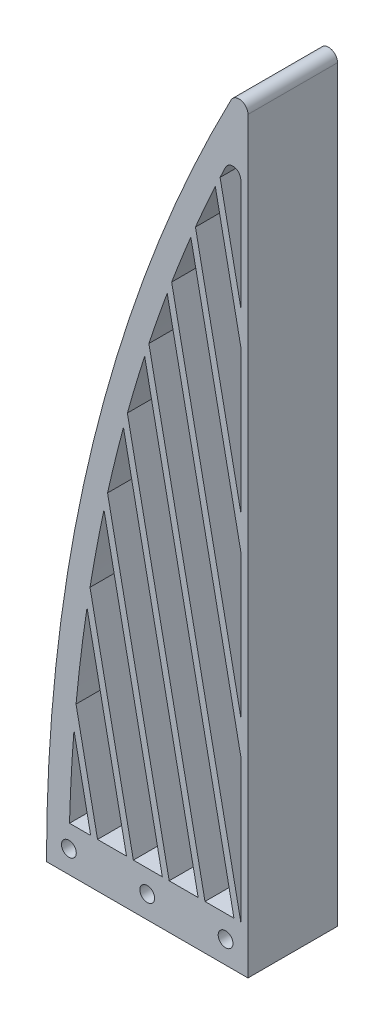
from build123d import *

# Parameters (mm, degrees)
BOSS_EXTRUDE4_DEPTH = 20
SKETCH12_R          = 1.65
CUT_EXTRUDE1_DEPTH  = 177.068006068
BOSS_EXTRUDE5_DEPTH = 20
CUT_EXTRUDE2_START  = -20
CUT_EXTRUDE2_DEPTH  = 20
LPATTERN2_DEPTH     = 20
CUT_EXTRUDE4_START  = -30
CUT_EXTRUDE4_DEPTH  = 30


with BuildPart() as part:
    # Sketch5 → Boss-Extrude4 (new body)
    with BuildSketch(Plane.XY):
        with BuildLine():
            Line((0, 0), (0, 167.041245738))
            ThreePointArc((0, 167.041245738), (-1.523254023, 168.9835931), (-3.772713274, 167.967252028))
            ThreePointArc((-3.772713274, 167.967252028), (-34.542452011, 86.476422979), (-45, 0))
            Line((-45, 0), (0, 0))
        make_face()
        with BuildLine():
            Line((-1.6, 10), (-39.860221142, 10))
            ThreePointArc((-39.860221142, 10), (-30.000299364, 83.996114978), (-5, 154.335493145))
            ThreePointArc((-5, 154.335493145), (-2.992115624, 155.307611869), (-1.6, 153.56444562))
            Line((-1.6, 153.56444562), (-1.6, 10))
        make_face(mode=Mode.SUBTRACT)
    extrude(amount=BOSS_EXTRUDE4_DEPTH)

    # Sketch12 → Cut-Extrude1 (cut, through all)
    with BuildSketch(Plane.XY.offset(20)):
        with Locations((-40, 5)):
            Circle(SKETCH12_R)
        with Locations((-22.5, 5)):
            Circle(SKETCH12_R)
        with Locations((-5, 5)):
            Circle(SKETCH12_R)
    extrude(amount=-CUT_EXTRUDE1_DEPTH, mode=Mode.SUBTRACT)

    # Sketch14 → Boss-Extrude5 (add)
    with BuildSketch(Plane.XY.offset(20)):
        Polygon((-31.6, 158.56444562), (-1.6, 10), (-3.070322034, 9.703094096), (-33.070322034, 158.267539717), align=None)
    extrude(amount=-BOSS_EXTRUDE5_DEPTH)

    # Sketch17 → Cut-Extrude2 (cut)
    with BuildSketch(Plane.XY.offset(20).offset(CUT_EXTRUDE2_START)):
        Polygon((-120.638203698, 868.825955305), (-109.129206393, -31.174044695), (790.870793607, -19.66504739), (784.13367644, 507.175413991), align=None)
        with BuildLine():
            Line((-45, 0), (0, 0))
            Line((0, 0), (0, 167.041245738))
            ThreePointArc((0, 167.041245738), (-1.523254023, 168.9835931), (-3.772713274, 167.967252028))
            ThreePointArc((-3.772713274, 167.967252028), (-34.542452011, 86.476422979), (-45, 0))
        make_face(mode=Mode.SUBTRACT)
    extrude(amount=CUT_EXTRUDE2_DEPTH, mode=Mode.SUBTRACT)

    # LPattern2: read off the stored shape, not the designer's step
    # LPattern2 outline → LPattern2 (add)
    with BuildSketch(Plane.XY):
        with BuildLine():
            ThreePointArc((-26.929923269, 95.820348103), (-27.373467662, 94.210169532), (-27.809490726, 92.59793799))
            Line((-27.809490726, 92.59793799), (-11.130277006, 10))
            Line((-11.130277006, 10), (-9.6, 10))
            Line((-9.6, 10), (-26.929923269, 95.820348103))
        make_face()
        with BuildLine():
            Line((-17.6, 10), (-31.361118804, 78.147099536))
            ThreePointArc((-31.361118804, 78.147099536), (-31.763386373, 76.327667567), (-32.156172589, 74.506165199))
            Line((-32.156172589, 74.506165199), (-19.130277006, 10))
            Line((-19.130277006, 10), (-17.6, 10))
        make_face()
        with BuildLine():
            Line((-25.6, 10), (-35.278805908, 57.930881129))
            ThreePointArc((-35.278805908, 57.930881129), (-35.62097033, 55.805583127), (-35.950341194, 53.67826488))
            Line((-35.950341194, 53.67826488), (-27.130277006, 10))
            Line((-27.130277006, 10), (-25.6, 10))
        make_face()
        with BuildLine():
            Line((-33.6, 10), (-38.401810118, 33.779275272))
            ThreePointArc((-38.401810118, 33.779275272), (-38.642670237, 31.135229386), (-38.863902948, 28.489468942))
            Line((-38.863902948, 28.489468942), (-35.130277006, 10))
            Line((-35.130277006, 10), (-33.6, 10))
        make_face()
        with BuildLine():
            Line((-39.6, 158.56444562), (-41.070322034, 158.267539717))
            Line((-41.070322034, 158.267539717), (-29.975183074, 103.322767425))
            ThreePointArc((-29.975183074, 103.322767425), (-29.520039112, 104.842464839), (-29.058254032, 106.360157429))
            Line((-29.058254032, 106.360157429), (-39.6, 158.56444562))
        make_face()
        with BuildLine():
            Line((-9.070322034, 158.267539717), (-8.948336076, 157.663447176))
            ThreePointArc((-8.948336076, 157.663447176), (-8.779938618, 158.011942308), (-8.611169445, 158.360257578))
            Line((-8.611169445, 158.360257578), (-9.070322034, 158.267539717))
        make_face()
        with BuildLine():
            Line((-17.070322034, 158.267539717), (-14.508363766, 145.580342723))
            ThreePointArc((-14.508363766, 145.580342723), (-13.985146964, 146.768790335), (-13.457679601, 147.955357539))
            Line((-13.457679601, 147.955357539), (-15.6, 158.56444562))
            Line((-15.6, 158.56444562), (-17.070322034, 158.267539717))
        make_face()
        with BuildLine():
            Line((-25.070322034, 158.267539717), (-19.890886638, 132.618208106))
            ThreePointArc((-19.890886638, 132.618208106), (-19.386082828, 133.896404549), (-18.876440608, 135.172679536))
            Line((-18.876440608, 135.172679536), (-23.6, 158.56444562))
            Line((-23.6, 158.56444562), (-25.070322034, 158.267539717))
        make_face()
        with BuildLine():
            ThreePointArc((-42.198101589, 45.000914697), (-41.903670312, 47.296637828), (-41.594598358, 49.590435769))
            Line((-41.594598358, 49.590435769), (-63.6, 158.56444562))
            Line((-63.6, 158.56444562), (-65.070322034, 158.267539717))
            Line((-65.070322034, 158.267539717), (-42.198101589, 45.000914697))
        make_face()
        with BuildLine():
            ThreePointArc((-38.7019538, 67.304658261), (-38.331864724, 69.236107391), (-37.951310909, 71.165521929))
            Line((-37.951310909, 71.165521929), (-55.6, 158.56444562))
            Line((-55.6, 158.56444562), (-57.070322034, 158.267539717))
            Line((-57.070322034, 158.267539717), (-38.7019538, 67.304658261))
        make_face()
        with BuildLine():
            ThreePointArc((-34.559404558, 86.407326039), (-34.139952511, 88.100097378), (-33.712367751, 89.79083275))
            Line((-33.712367751, 89.79083275), (-47.6, 158.56444562))
            Line((-47.6, 158.56444562), (-49.070322034, 158.267539717))
            Line((-49.070322034, 158.267539717), (-34.559404558, 86.407326039))
        make_face()
        with BuildLine():
            ThreePointArc((-17.043254073, 126.094468165), (-17.541868523, 124.762466617), (-18.035183962, 123.428493465))
            Line((-18.035183962, 123.428493465), (-1.6, 42.039026998))
            Line((-1.6, 42.039026998), (-1.6, 49.617185499))
            Line((-1.6, 49.617185499), (-17.043254073, 126.094468165))
        make_face()
        with BuildLine():
            ThreePointArc((-11.728678792, 139.39308932), (-12.247145872, 138.161094529), (-12.761006653, 136.927171366))
            Line((-12.761006653, 136.927171366), (-1.6, 81.656212497))
            Line((-1.6, 81.656212497), (-1.6, 89.234370998))
            Line((-1.6, 89.234370998), (-11.728678792, 139.39308932))
        make_face()
        with BuildLine():
            ThreePointArc((-6.2238307, 151.749451318), (-6.759005375, 150.601509463), (-7.290112892, 149.451680241))
            Line((-7.290112892, 149.451680241), (-1.6, 121.273397996))
            Line((-1.6, 121.273397996), (-1.6, 128.851556496))
            Line((-1.6, 128.851556496), (-6.2238307, 151.749451318))
        make_face()
        Polygon((0, 41.693748399), (0, 34.115589899), (4.929677966, 9.703094096), (6.4, 10), align=None)
        Polygon((0, 158.483672593), (0, 152.967146395), (28.929677966, 9.703094096), (30.4, 10), (0.4, 158.56444562), align=None)
        Polygon((0, 120.928119397), (0, 113.349960896), (20.929677966, 9.703094096), (22.4, 10), align=None)
        Polygon((0, 81.310933898), (0, 73.732775397), (12.929677966, 9.703094096), (14.4, 10), align=None)
    extrude(amount=LPATTERN2_DEPTH)

    # Sketch19 → Cut-Extrude4 (cut)
    with BuildSketch(Plane.XY.offset(20).offset(CUT_EXTRUDE4_START)):
        Polygon((-113.909990018, -19.131609845), (183.246695872, -29.17634289), (134.697152825, 220.267861041), (-171.248674479, 235.334960607), align=None)
        with BuildLine():
            Line((-45, 0), (0, 0))
            Line((0, 0), (0, 167.041245738))
            ThreePointArc((0, 167.041245738), (-1.523254023, 168.9835931), (-3.772713274, 167.967252028))
            ThreePointArc((-3.772713274, 167.967252028), (-34.542452011, 86.476422979), (-45, 0))
        make_face(mode=Mode.SUBTRACT)
    extrude(amount=CUT_EXTRUDE4_DEPTH, mode=Mode.SUBTRACT)


solid = part.part
